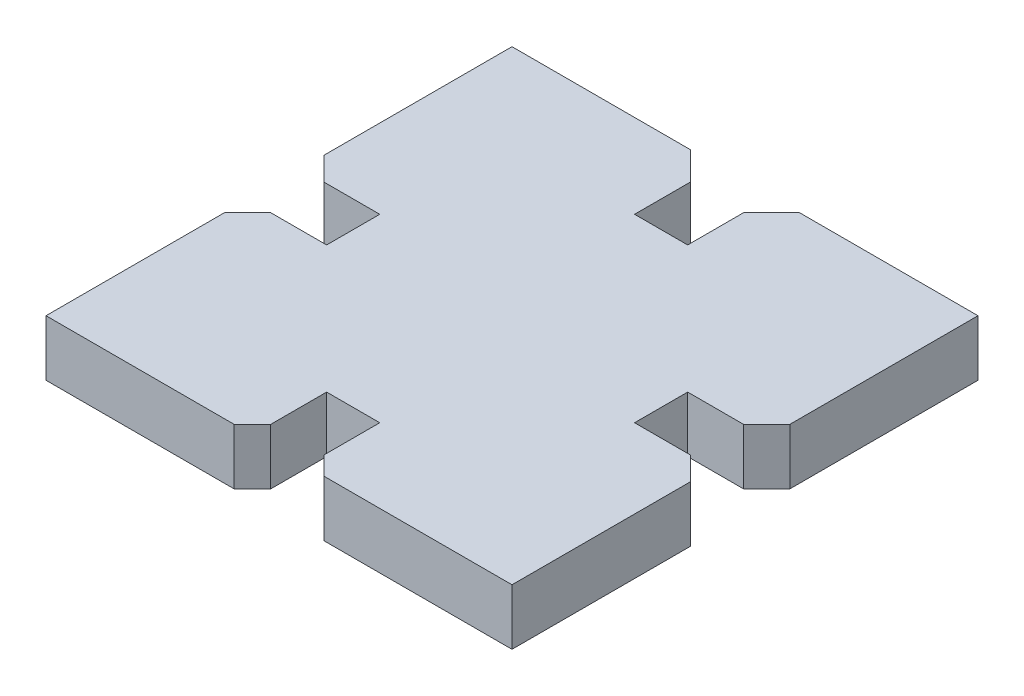
from build123d import *

# Parameters (mm, degrees)
SKETCH1_W           = 50
SKETCH1_H           = 50
BOSS_EXTRUDE1_DEPTH = 6
SKETCH2_W           = 5.7
SKETCH2_H           = 9
CUT_EXTRUDE1_DEPTH  = 6
CHAMFER2_SIZE       = 3
CIRPATTERN4_DEPTH   = 6


# Read off the part's stored shape, not the designer's step: CirPattern4
with BuildPart() as part:
    # Sketch1 → Boss-Extrude1 (new body)
    with BuildSketch(Plane(origin=(0, 0, 0), x_dir=(1, 0, 0), z_dir=(0, 1, 0))):
        with Locations((25, 25)):
            Rectangle(SKETCH1_W, SKETCH1_H)
    extrude(amount=BOSS_EXTRUDE1_DEPTH)

    # Sketch2 → Cut-Extrude1 (cut)
    with BuildSketch(Plane(origin=(0, 6, 0), x_dir=(1, 0, 0), z_dir=(0, 1, 0))):
        with Locations((25, 45.5)):
            Rectangle(SKETCH2_W, SKETCH2_H)
    extrude(amount=-CUT_EXTRUDE1_DEPTH, mode=Mode.SUBTRACT)

    # Chamfer2
    chamfer2_edges = [part.edges().sort_by_distance(p)[0] for p in [
        (22.15, 3, -50),
        (27.85, 3, -50),
    ]]
    chamfer(chamfer2_edges, length=CHAMFER2_SIZE)

    # CirPattern4 outline → CirPattern4 (cut)
    with BuildSketch(Plane(origin=(0, 0, 0), x_dir=(1, 0, 0), z_dir=(0, 1, 0))):
        Polygon((27.85, 7.960814854), (22.15, 7.960814854), (22.15, 1.960814854), (20.189185146, 0), (29.810814854, 0), (27.85, 1.960814854), align=None)
        Polygon((47.519592573, 21.630407427), (50, 19.15), (50, 29.810814854), (47.519592573, 27.330407427), (41.519592573, 27.330407427), (41.519592573, 21.630407427), align=None)
        Polygon((0, 29.810814854), (0, 19.15), (2.480407427, 21.630407427), (8.480407427, 21.630407427), (8.480407427, 27.330407427), (2.480407427, 27.330407427), align=None)
    extrude(amount=CIRPATTERN4_DEPTH, mode=Mode.SUBTRACT)


solid = part.part
